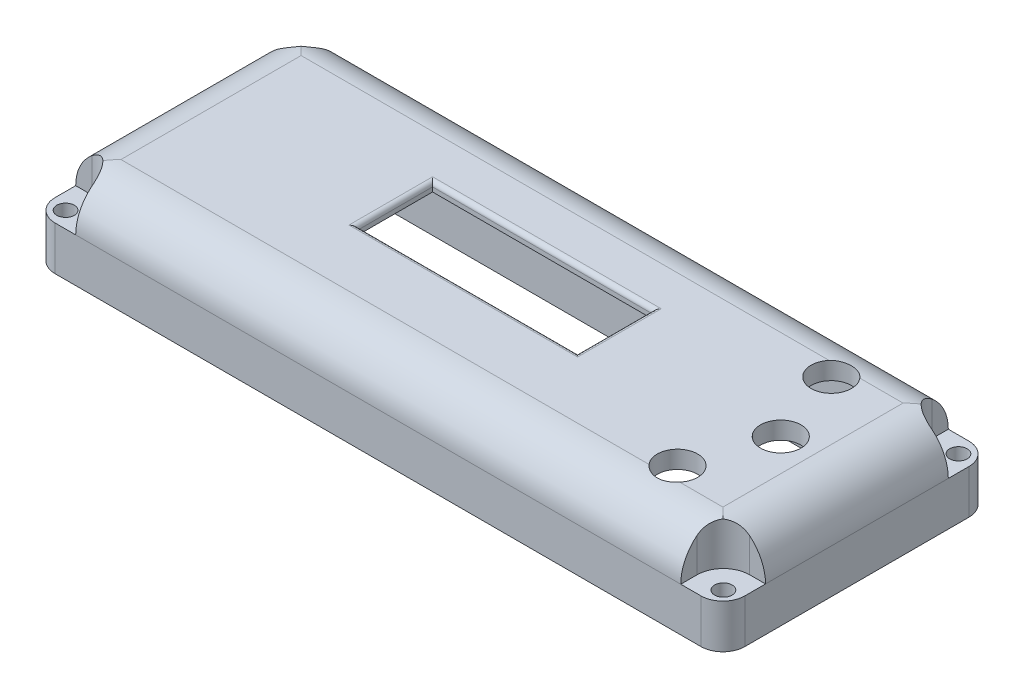
from build123d import *

# Parameters (mm, degrees)
EXTRUDE_1276_DEPTH          = 10
CUT_EXTRUDE_1340_DEPTH      = 8
EXTRUDE_1406_DEPTH          = 2
CUT_EXTRUDE_1479_DEPTH      = 2
CUT_EXTRUDE_1479_DEPTH_BACK = 2
CUT_EXTRUDE_1550_DEPTH      = 44.279614139
CUT_EXTRUDE_1550_DEPTH_BACK = 44.279614139
SKETCH_1_7_R                = 1
USB_REACH                   = 80.4
USB_2_W                     = 10
USB_2_H                     = 2
CUT_EXTRUDE_START           = -5
SKETCH_3_R                  = 1
CUT_EXTRUDE_3145_DEPTH      = 5
FILLET_3202_R               = 5
CUT_EXTRUDE_3663_DEPTH      = 44.279614288
CUT_EXTRUDE_3663_DEPTH_BACK = 44.279614288
SKETCH_8_W                  = 25.017119527
SKETCH_8_H                  = 8.52
SKETCH_11_W                 = 40
SKETCH_11_H                 = 14
CUT_EXTRUDE_3720_DEPTH      = 9
FILLET_3777_R               = 0.5
CUT_EXTRUDE_12_REACH        = 82.59
USB_4_R                     = 1
CUT_EXTRUDE_4523_DEPTH      = 44.279614288
CUT_EXTRUDE_4523_DEPTH_BACK = 44.279614288
SKETCH_13_R                 = 2.3


with BuildPart() as part:
    # Sketch 378 → Extrude 1276 (new body)
    with BuildSketch(Plane(origin=(0, 0, 0), x_dir=(1, 0, 0), z_dir=(0, 1, 0))):
        with BuildLine():
            Line((-39.25, 12.75), (-39.25, -12.75))
            ThreePointArc((-39.25, -12.75), (-38.517766953, -14.517766953), (-36.75, -15.25))
            Line((-36.75, -15.25), (36.75, -15.25))
            ThreePointArc((36.75, -15.25), (38.517766953, -14.517766953), (39.25, -12.75))
            Line((39.25, -12.75), (39.25, 12.75))
            ThreePointArc((39.25, 12.75), (38.517766953, 14.517766953), (36.75, 15.25))
            Line((36.75, 15.25), (-36.75, 15.25))
            ThreePointArc((-36.75, 15.25), (-38.517766953, 14.517766953), (-39.25, 12.75))
        make_face()
    extrude(amount=EXTRUDE_1276_DEPTH)

    # Эскиз1<3> → Cut-Extrude 1340 (cut)
    with BuildSketch(Plane(origin=(0, 0, 0), x_dir=(1, 0, 0), z_dir=(0, 1, 0))):
        with BuildLine():
            Line((33.968871126, 12), (-33.968871126, 12))
            ThreePointArc((-33.968871126, 12), (-34.818019485, 10.818019485), (-36, 9.968871126))
            Line((-36, 9.968871126), (-36, -9.968871126))
            ThreePointArc((-36, -9.968871126), (-34.818019485, -10.818019485), (-33.968871126, -12))
            Line((-33.968871126, -12), (33.968871126, -12))
            ThreePointArc((33.968871126, -12), (34.818019485, -10.818019485), (36, -9.968871126))
            Line((36, -9.968871126), (36, 9.968871126))
            ThreePointArc((36, 9.968871126), (34.818019485, 10.818019485), (33.968871126, 12))
        make_face()
    extrude(amount=CUT_EXTRUDE_1340_DEPTH, mode=Mode.SUBTRACT)

    # Эскиз1<4> → Extrude 1406 (add)
    with BuildSketch(Plane(origin=(0, 0, 0), x_dir=(1, 0, 0), z_dir=(0, 1, 0))):
        with BuildLine():
            Line((34.645898034, 13), (-34.645898034, 13))
            ThreePointArc((-34.645898034, 13), (-35.525126266, 11.525126266), (-37, 10.645898034))
            Line((-37, 10.645898034), (-37, -10.645898034))
            ThreePointArc((-37, -10.645898034), (-35.525126266, -11.525126266), (-34.645898034, -13))
            Line((-34.645898034, -13), (34.645898034, -13))
            ThreePointArc((34.645898034, -13), (35.525126266, -11.525126266), (37, -10.645898034))
            Line((37, -10.645898034), (37, 10.645898034))
            ThreePointArc((37, 10.645898034), (35.525126266, 11.525126266), (34.645898034, 13))
        make_face()
    extrude(amount=-EXTRUDE_1406_DEPTH)

    # Эскиз1<6> → Cut-Extrude 1479 (cut, two sides: drawn at the far end of the back side and taken through both)
    with BuildSketch(Plane(origin=(0, 0, 0), x_dir=(1, 0, 0), z_dir=(0, 1, 0)).offset(-CUT_EXTRUDE_1479_DEPTH_BACK)):
        with BuildLine():
            Line((33.968871126, 12), (-33.968871126, 12))
            ThreePointArc((-33.968871126, 12), (-34.818019485, 10.818019485), (-36, 9.968871126))
            Line((-36, 9.968871126), (-36, -9.968871126))
            ThreePointArc((-36, -9.968871126), (-34.818019485, -10.818019485), (-33.968871126, -12))
            Line((-33.968871126, -12), (33.968871126, -12))
            ThreePointArc((33.968871126, -12), (34.818019485, -10.818019485), (36, -9.968871126))
            Line((36, -9.968871126), (36, 9.968871126))
            ThreePointArc((36, 9.968871126), (34.818019485, 10.818019485), (33.968871126, 12))
        make_face()
    extrude(amount=CUT_EXTRUDE_1479_DEPTH + CUT_EXTRUDE_1479_DEPTH_BACK, mode=Mode.SUBTRACT)

    # Эскиз1<7> → Cut-Extrude 1550 (cut, two sides: drawn at the far end of the back side and taken through both)
    with BuildSketch(Plane(origin=(0, 0, 0), x_dir=(1, 0, 0), z_dir=(0, 1, 0)).offset(-CUT_EXTRUDE_1550_DEPTH_BACK)):
        with Locations(Location((37.454174909, -13.4, 0), (0, 0, 270))):
            Circle(SKETCH_1_7_R)
        with Locations(Location((-37.4, 13.4, 0), (0, 0, 270))):
            Circle(SKETCH_1_7_R)
        with Locations(Location((37.4, 13.4, 0), (0, 0, 270))):
            Circle(SKETCH_1_7_R)
        with Locations(Location((-37.4, -13.4, 0), (0, 0, 270))):
            Circle(SKETCH_1_7_R)
    extrude(amount=CUT_EXTRUDE_1550_DEPTH + CUT_EXTRUDE_1550_DEPTH_BACK, mode=Mode.SUBTRACT)

    # USB 2 → USB (cut, up to next)
    with BuildSketch(Plane.ZY.offset(37), mode=Mode.PRIVATE) as usb_sk1:
        with Locations((0, -1)):
            Rectangle(USB_2_W, USB_2_H)
    usb_tool1 = extrude(usb_sk1.sketch, amount=-USB_REACH, mode=Mode.PRIVATE) & part.part
    add(usb_tool1.solids().sort_by_distance((-37, -1, 0))[0], mode=Mode.SUBTRACT)

    # Эскиз3 → Cut-Extrude 3145 (cut)
    # profile 1 of 4: a face of its own
    with BuildSketch(Plane(origin=(0, 10, 0), x_dir=(1, 0, 0), z_dir=(0, 1, 0)).offset(CUT_EXTRUDE_START)):
        with BuildLine():
            Line((-34.4, 13.4), (-34.4, 15.25))
            Line((-34.4, 15.25), (-36.75, 15.25))
            ThreePointArc((-36.75, 15.25), (-38.517766953, 14.517766953), (-39.25, 12.75))
            Line((-39.25, 12.75), (-39.25, 10.4))
            Line((-39.25, 10.4), (-37.4, 10.4))
            ThreePointArc((-37.4, 10.4), (-35.278679656, 11.278679656), (-34.4, 13.4))
        make_face()
        with Locations(Location((-37.4, 13.4, 0), (0, 0, 270))):
            Circle(SKETCH_3_R, mode=Mode.SUBTRACT)
    # profile 2 of 4: a face of its own
    with BuildSketch(Plane(origin=(0, 10, 0), x_dir=(1, 0, 0), z_dir=(0, 1, 0)).offset(CUT_EXTRUDE_START)):
        with BuildLine():
            Line((-36.75, -15.25), (-34.4, -15.25))
            Line((-34.4, -15.25), (-34.4, -13.4))
            ThreePointArc((-34.4, -13.4), (-35.278679656, -11.278679656), (-37.4, -10.4))
            Line((-37.4, -10.4), (-39.25, -10.4))
            Line((-39.25, -10.4), (-39.25, -12.75))
            ThreePointArc((-39.25, -12.75), (-38.517766953, -14.517766953), (-36.75, -15.25))
        make_face()
        with Locations(Location((-37.4, -13.4, 0), (0, 0, 270))):
            Circle(SKETCH_3_R, mode=Mode.SUBTRACT)
    # profile 3 of 4: a face of its own
    with BuildSketch(Plane(origin=(0, 10, 0), x_dir=(1, 0, 0), z_dir=(0, 1, 0)).offset(CUT_EXTRUDE_START)):
        with BuildLine():
            ThreePointArc((36.75, -15.25), (38.517766953, -14.517766953), (39.25, -12.75))
            Line((39.25, -12.75), (39.25, -10.4))
            Line((39.25, -10.4), (37.454174909, -10.4))
            ThreePointArc((37.454174909, -10.4), (35.332854565, -11.278679656), (34.454174909, -13.4))
            Line((34.454174909, -13.4), (34.454174909, -15.25))
            Line((34.454174909, -15.25), (36.75, -15.25))
        make_face()
        with Locations(Location((37.454174909, -13.4, 0), (0, 0, 270))):
            Circle(SKETCH_3_R, mode=Mode.SUBTRACT)
    # profile 4 of 4: a face of its own
    with BuildSketch(Plane(origin=(0, 10, 0), x_dir=(1, 0, 0), z_dir=(0, 1, 0)).offset(CUT_EXTRUDE_START)):
        with BuildLine():
            Line((37.4, 10.4), (39.25, 10.4))
            Line((39.25, 10.4), (39.25, 12.75))
            ThreePointArc((39.25, 12.75), (38.517766953, 14.517766953), (36.75, 15.25))
            Line((36.75, 15.25), (34.4, 15.25))
            Line((34.4, 15.25), (34.4, 13.4))
            ThreePointArc((34.4, 13.4), (35.278679656, 11.278679656), (37.4, 10.4))
        make_face()
        with Locations(Location((37.4, 13.4, 0), (0, 0, 270))):
            Circle(SKETCH_3_R, mode=Mode.SUBTRACT)
    extrude(amount=CUT_EXTRUDE_3145_DEPTH, mode=Mode.SUBTRACT)

    # Fillet 3202
    # the kernel refuses this fillet: 5 mm, written as the material it takes off along each edge
    with BuildSketch(Plane(origin=(-39.25, 10, -22.9), x_dir=(0, -1, 0), z_dir=(0, 0, 1)), Plane(origin=(39.25, 10, 22.9), x_dir=(0, -1, 0), z_dir=(0, 0, -1))) as fillet_3202_piece_1:
        with BuildLine():
            CenterArc((FILLET_3202_R, FILLET_3202_R), FILLET_3202_R, 180, 90)
            Line((0, FILLET_3202_R), (0, 0))
            Line((0, 0), (FILLET_3202_R, 0))
        make_face()
    extrude(amount=45.8, mode=Mode.SUBTRACT)
    with BuildSketch(Plane(origin=(46.9, 10, -15.25), x_dir=(0, -1, 0), z_dir=(-1, 0, 0))) as fillet_3202_piece_2:
        with BuildLine():
            CenterArc((FILLET_3202_R, FILLET_3202_R), FILLET_3202_R, 180, 90)
            Line((0, FILLET_3202_R), (0, 0))
            Line((0, 0), (FILLET_3202_R, 0))
        make_face()
    extrude(amount=93.8, mode=Mode.SUBTRACT)
    with BuildSketch(Plane(origin=(-46.9, 10, 15.25), x_dir=(0, -1, 0), z_dir=(1, 0, 0))) as fillet_3202_piece_3:
        with BuildLine():
            CenterArc((FILLET_3202_R, FILLET_3202_R), FILLET_3202_R, 180, 90)
            Line((0, FILLET_3202_R), (0, 0))
            Line((0, 0), (FILLET_3202_R, 0))
        make_face()
    extrude(amount=93.854174909, mode=Mode.SUBTRACT)

    # основной эскиз<8> → Cut-Extrude 3663 (cut, two sides: drawn at the far end of the back side and taken through both)
    with BuildSketch(Plane(origin=(0, 0, 0), x_dir=(1, 0, 0), z_dir=(0, 1, 0)).offset(-CUT_EXTRUDE_3663_DEPTH_BACK)):
        with Locations((-1.813623337, 1.023507904)):
            Rectangle(SKETCH_8_W, SKETCH_8_H)
    extrude(amount=CUT_EXTRUDE_3663_DEPTH + CUT_EXTRUDE_3663_DEPTH_BACK, mode=Mode.SUBTRACT)

    # основной эскиз<11> → Cut-Extrude 3720 (cut)
    with BuildSketch(Plane(origin=(0, 0, 0), x_dir=(1, 0, 0), z_dir=(0, 1, 0))):
        with Locations((-0.9221831, -0.056492096)):
            Rectangle(SKETCH_11_W, SKETCH_11_H)
    extrude(amount=CUT_EXTRUDE_3720_DEPTH, mode=Mode.SUBTRACT)

    # Fillet 3777
    fillet_3777_edges = [part.edges().sort_by_distance(p)[0] for p in [
        (10.694936427, 10, -1.023507904),
        (-1.813623336, 10, -5.283507904),
        (-14.3221831, 10, -1.023507904),
        (-1.813623336, 10, 3.236492096),
    ]]
    fillet(fillet_3777_edges, radius=FILLET_3777_R)

    # USB 3 → Вырез-Вытянуть12 (cut, up to next)
    with BuildSketch(Plane.ZY.offset(39.25), mode=Mode.PRIVATE) as cut_extrude_12_sk1:
        Polygon((-4.125, -0.7), (4.125, -0.7), (4.125, 0), (3.635102051, 0.8), (-3.635102051, 0.8), (-4.125, 0), align=None)
    cut_extrude_12_tool1 = extrude(cut_extrude_12_sk1.sketch, amount=-CUT_EXTRUDE_12_REACH, mode=Mode.PRIVATE) & part.part
    add(cut_extrude_12_tool1.solids().sort_by_distance((-39.25, 0.034192, 0))[0], mode=Mode.SUBTRACT)

    # USB 4
    usb_4_edges = [part.edges().sort_by_distance(p)[0] for p in [
        (-37.625, 0.8, 3.635102051),
        (-37.625, 0.8, -3.635102051),
    ]]
    fillet(usb_4_edges, radius=USB_4_R)

    # основной эскиз<13> → Cut-Extrude 4523 (cut, two sides: drawn at the far end of the back side and taken through both)
    with BuildSketch(Plane(origin=(0, 0, 0), x_dir=(1, 0, 0), z_dir=(0, 1, 0)).offset(-CUT_EXTRUDE_4523_DEPTH_BACK)):
        with Locations(Location((27.584507944, 8.749878541, 0), (0, 0, 270))):
            Circle(SKETCH_13_R)
        with Locations(Location((30.584507944, -0.000121459, 0), (0, 0, 270))):
            Circle(SKETCH_13_R)
        with Locations(Location((27.584507944, -8.750117644, 0), (0, 0, 270))):
            Circle(SKETCH_13_R)
    extrude(amount=CUT_EXTRUDE_4523_DEPTH + CUT_EXTRUDE_4523_DEPTH_BACK, mode=Mode.SUBTRACT)


solid = part.part
